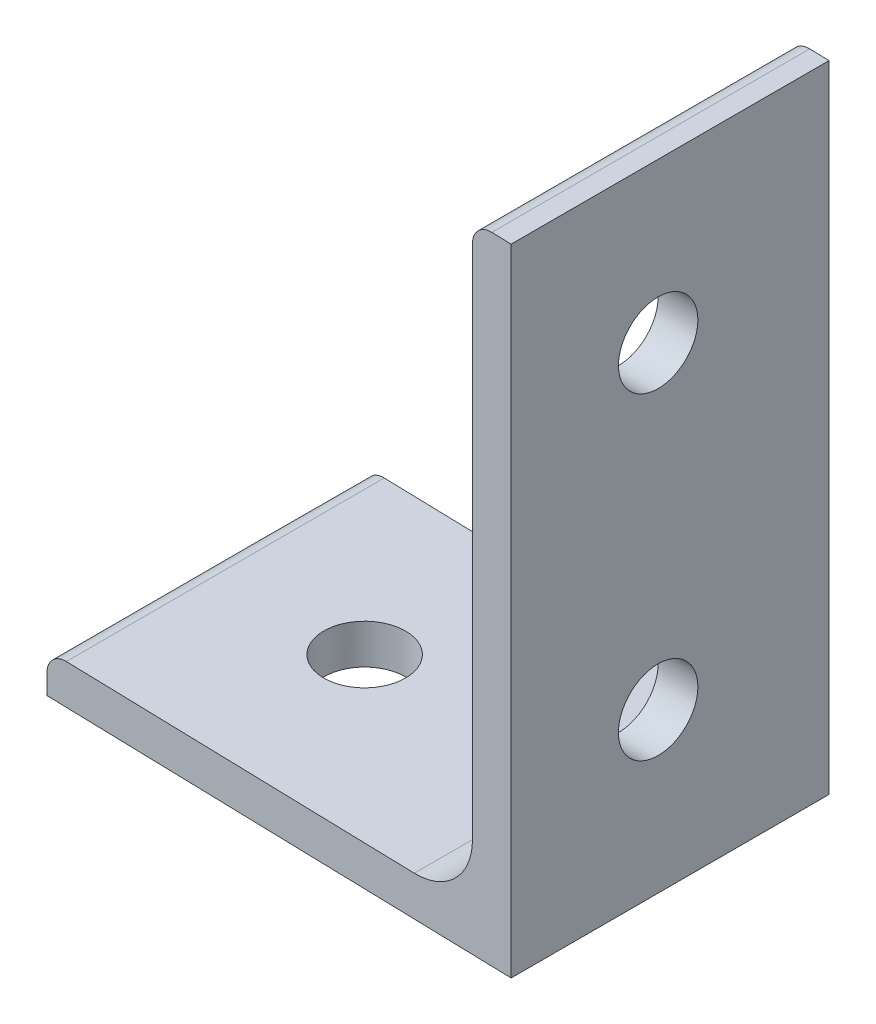
from build123d import *

# Parameters (mm, degrees)
BOSS_EXTRUDE1_DEPTH     = 15.875
SKETCH4_R               = 3.175
CUT_EXTRUDE1_DEPTH      = 49.464271634
SKETCH3_OUTSIDE_W       = 54.3
SKETCH3_OUTSIDE_H       = 47.95
CUT_EXTRUDE2_DEPTH      = 57.529267862
F_1_4_CLEARANCE_HOLE1_D = 6.5278


with BuildPart() as part:
    # Sketch2 → Boss-Extrude1 (new, symmetric)
    with BuildSketch(Plane.XY):
        with BuildLine():
            Line((-19.05, -25.4), (19.05, -25.4))
            Line((19.05, -25.4), (19.05, 25.4))
            Line((19.05, 25.4), (17.4625, 25.4))
            ThreePointArc((17.4625, 25.4), (16.339967985, 24.935032015), (15.875, 23.8125))
            Line((15.875, 23.8125), (15.875, -17.4498))
            ThreePointArc((15.875, -17.4498), (14.476376302, -20.826376302), (11.0998, -22.225))
            Line((11.0998, -22.225), (-17.4625, -22.225))
            ThreePointArc((-17.4625, -22.225), (-18.585032015, -22.689967985), (-19.05, -23.8125))
            Line((-19.05, -23.8125), (-19.05, -25.4))
        make_face()
    extrude(amount=BOSS_EXTRUDE1_DEPTH, both=True)

    # Sketch4 → Cut-Extrude1 (cut, through all)
    with BuildSketch(Plane(origin=(19.05, 0, 0), x_dir=(0, 0, -1), z_dir=(1, 0, 0))):
        with Locations((-3.175, 12.7)):
            Circle(SKETCH4_R)
        with Locations((-3.175, -12.7)):
            Circle(SKETCH4_R)
    extrude(amount=-CUT_EXTRUDE1_DEPTH, mode=Mode.SUBTRACT)

    # Sketch3 outside → Cut-Extrude2 (cut, through all)
    with BuildSketch(Plane.XZ.offset(25.4)):
        Rectangle(SKETCH3_OUTSIDE_W, SKETCH3_OUTSIDE_H)
        Polygon((19.05, -10.484188491), (19.05, 14.924518438), (-19.05, 13.926834826), (-18.385105513, -11.464461228), align=None, mode=Mode.SUBTRACT)
    extrude(amount=-CUT_EXTRUDE2_DEPTH, mode=Mode.SUBTRACT)

    # 1/4 Clearance Hole1 (through all)
    with Locations(Plane(origin=(0, -25.4, 0), x_dir=(-1, 0, 0), z_dir=(0, -1, 0))):
        with Locations((6.021904729, -1.56363455)):
            Hole(F_1_4_CLEARANCE_HOLE1_D / 2)


solid = part.part
